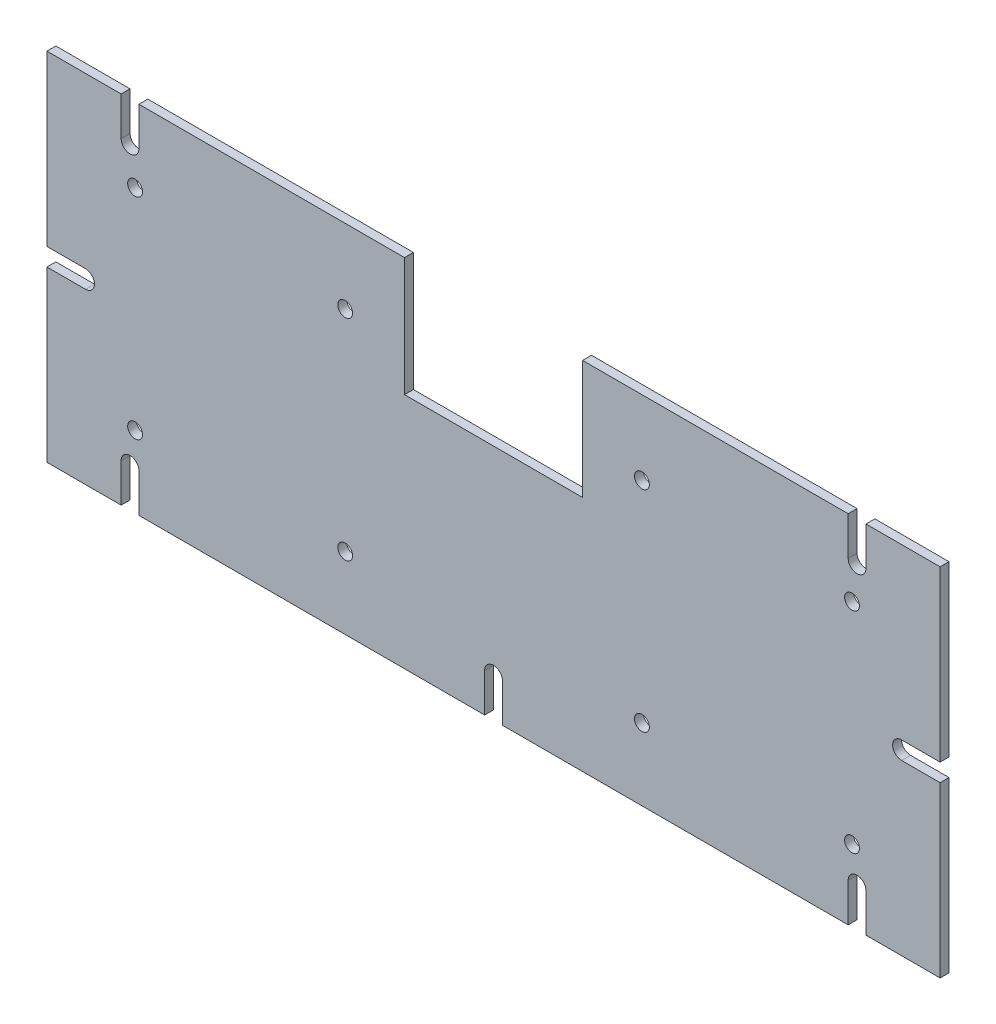
from build123d import *

# Parameters (mm, degrees)
SKETCH1_W           = 301
SKETCH1_H           = 120
BOSS_EXTRUDE1_DEPTH = 3
SKETCH2_W           = 60
SKETCH2_H           = 40
CUT_EXTRUDE1_DEPTH  = 3
CUT_EXTRUDE2_DEPTH  = 10
SKETCH5_R           = 2.5
CUT_EXTRUDE3_DEPTH  = 10


with BuildPart() as part:
    # Sketch1 → Boss-Extrude1 (new body)
    with BuildSketch(Plane.XY):
        Rectangle(SKETCH1_W, SKETCH1_H)
    extrude(amount=BOSS_EXTRUDE1_DEPTH)

    # Sketch2 → Cut-Extrude1 (cut)
    with BuildSketch(Plane.XY.offset(3)):
        with Locations((0, 40)):
            Rectangle(SKETCH2_W, SKETCH2_H)
    extrude(amount=-CUT_EXTRUDE1_DEPTH, mode=Mode.SUBTRACT)

    # Sketch4 → Cut-Extrude2 (cut)
    with BuildSketch(Plane.XY.offset(3)):
        with BuildLine():
            Line((125.5, 47), (125.5, 60))
            Line((125.5, 60), (119.5, 60))
            Line((119.5, 60), (119.5, 47))
            ThreePointArc((119.5, 47), (122.5, 44), (125.5, 47))
        make_face()
        with BuildLine():
            Line((137.5, -3), (150.5, -3))
            Line((150.5, -3), (150.5, 3))
            Line((150.5, 3), (137.5, 3))
            ThreePointArc((137.5, 3), (134.5, 0), (137.5, -3))
        make_face()
        with BuildLine():
            Line((119.5, -47), (119.5, -60))
            Line((119.5, -60), (125.5, -60))
            Line((125.5, -60), (125.5, -47))
            ThreePointArc((125.5, -47), (122.5, -44), (119.5, -47))
        make_face()
        with BuildLine():
            Line((-3, -47), (-3, -60))
            Line((-3, -60), (3, -60))
            Line((3, -60), (3, -47))
            ThreePointArc((3, -47), (0, -44), (-3, -47))
        make_face()
        with BuildLine():
            Line((-125.5, -47), (-125.5, -60))
            Line((-125.5, -60), (-119.5, -60))
            Line((-119.5, -60), (-119.5, -47))
            ThreePointArc((-119.5, -47), (-122.5, -44), (-125.5, -47))
        make_face()
        with BuildLine():
            Line((-150.5, 3), (-150.5, -3))
            Line((-150.5, -3), (-137.5, -3))
            ThreePointArc((-137.5, -3), (-134.5, 0), (-137.5, 3))
            Line((-137.5, 3), (-150.5, 3))
        make_face()
        with BuildLine():
            Line((-119.5, 47), (-119.5, 60))
            Line((-119.5, 60), (-125.5, 60))
            Line((-125.5, 60), (-125.5, 47))
            ThreePointArc((-125.5, 47), (-122.5, 44), (-119.5, 47))
        make_face()
    extrude(amount=-CUT_EXTRUDE2_DEPTH, mode=Mode.SUBTRACT)

    # Sketch5 → Cut-Extrude3 (cut)
    with BuildSketch(Plane.XY.offset(3)):
        with Locations((120.8, 35)):
            Circle(SKETCH5_R)
        with Locations((120.8, -35.8)):
            Circle(SKETCH5_R)
        with Locations((50, 35)):
            Circle(SKETCH5_R)
        with Locations((50, -35.8)):
            Circle(SKETCH5_R)
    cut_extrude3 = extrude(amount=-CUT_EXTRUDE3_DEPTH, mode=Mode.SUBTRACT)

    # Mirror1: Cut-Extrude3 across plane
    add(cut_extrude3.mirror(Plane.ZY), mode=Mode.SUBTRACT)


solid = part.part
